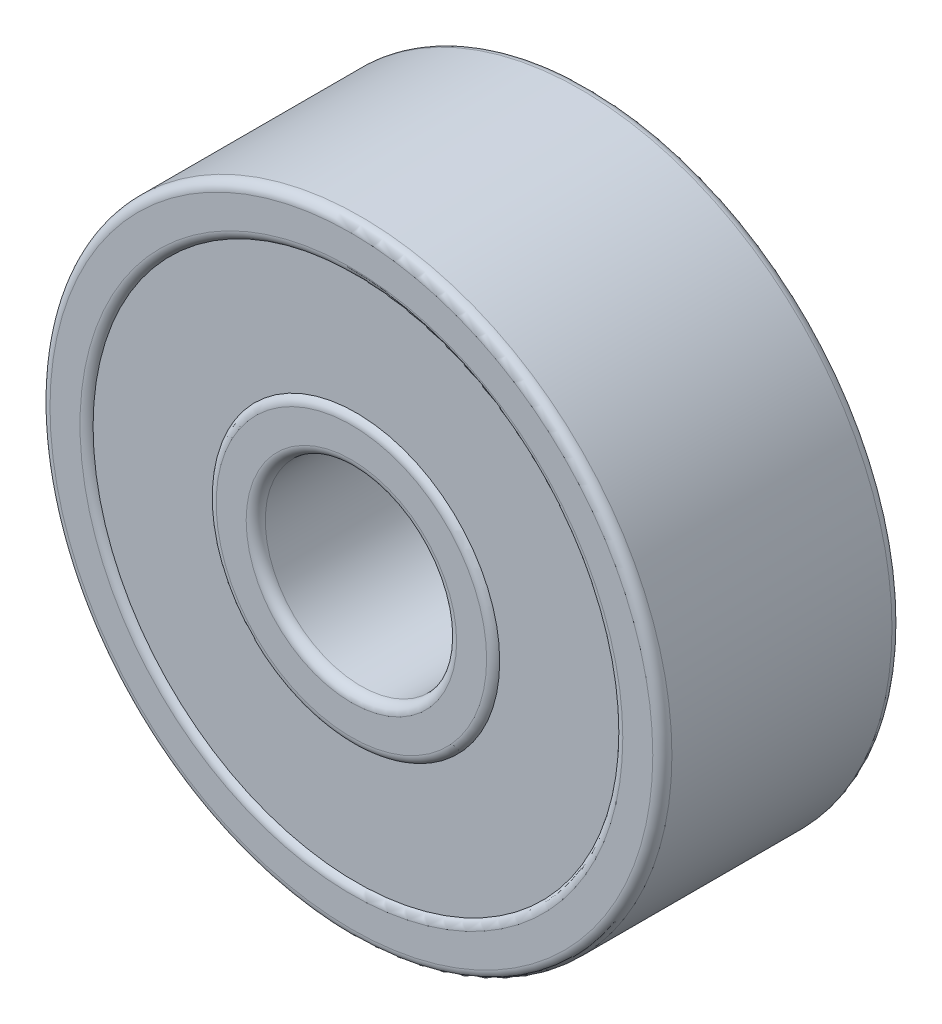
from build123d import *

# Parameters (mm, degrees)
ESQUISSE1_R             = 6.5
ESQUISSE1_R_2           = 5.5
ESQUISSE1_R_3           = 3
ESQUISSE1_R_4           = 2
BOSS_EXTRU_1_DEPTH      = 5
ESQUISSE1_3_R           = 5.5
ESQUISSE1_3_R_2         = 3
ENL_V_MAT_EXTRU_1_DEPTH = 0.1
ENL_V_START             = -0.1
ESQUISSE2_R             = 5.5
ESQUISSE2_R_2           = 3
ENL_V_MAT_EXTRU_2_DEPTH = 0.1
CONG_1_R                = 0.2


with BuildPart() as part:
    # Esquisse1 → Boss.-Extru.1 (new body)
    # profile 1 of 3: a face of its own
    with BuildSketch(Plane.XY):
        Circle(ESQUISSE1_R)
        Circle(ESQUISSE1_R_2, mode=Mode.SUBTRACT)
    # profile 2 of 3: a face of its own
    with BuildSketch(Plane.XY):
        Circle(ESQUISSE1_R_2)
        Circle(ESQUISSE1_R_3, mode=Mode.SUBTRACT)
    # profile 3 of 3: a face of its own
    with BuildSketch(Plane.XY):
        Circle(ESQUISSE1_R_3)
        Circle(ESQUISSE1_R_4, mode=Mode.SUBTRACT)
    extrude(amount=BOSS_EXTRU_1_DEPTH)

    # Esquisse1<3> → Enlèv. mat.-Extru.1 (cut)
    with BuildSketch(Plane.XY):
        Circle(ESQUISSE1_3_R)
        Circle(ESQUISSE1_3_R_2, mode=Mode.SUBTRACT)
    extrude(amount=ENL_V_MAT_EXTRU_1_DEPTH, mode=Mode.SUBTRACT)

    # Esquisse2 → Enlèv. mat.-Extru.2 (cut)
    with BuildSketch(Plane.XY.offset(5).offset(ENL_V_START)):
        Circle(ESQUISSE2_R)
        Circle(ESQUISSE2_R_2, mode=Mode.SUBTRACT)
    extrude(amount=ENL_V_MAT_EXTRU_2_DEPTH, mode=Mode.SUBTRACT)

    # Congé1
    # the kernel refuses this fillet: 0.2 mm, written as the material it takes off along each edge
    with BuildSketch(Plane(origin=(0, 0, 0), x_dir=(1, 0, 0), z_dir=(0, -1, 0))) as cong_1_piece_1:
        with BuildLine():
            CenterArc((5.673205081, 0.2), CONG_1_R, 210, 60)
            Line((5.5, 0.1), (5.496535898, 0.098))
            ThreePointArc((5.496535898, 0.098), (5.496, 0.05), (5.496, 0))
            Line((5.496, 0), (5.5, -0.004))
            Line((5.5, -0.004), (5.673205081, -0.004))
            Line((5.673205081, -0.004), (5.673205081, 0))
        make_face()
    revolve(axis=Axis((0, 0, 0), (0, 0, 1)), mode=Mode.SUBTRACT)
    with BuildSketch(Plane(origin=(0, 0, 0), x_dir=(1, 0, 0), z_dir=(0, -1, 0))) as cong_1_piece_2:
        with BuildLine():
            CenterArc((2.826794919, 0.2), CONG_1_R, 270, 60)
            Line((2.826794919, 0), (2.826794919, -0.004))
            Line((2.826794919, -0.004), (3, -0.004))
            Line((3, -0.004), (3.004, 0))
            ThreePointArc((3.004, 0), (3.004, 0.05), (3.003464102, 0.098))
            Line((3.003464102, 0.098), (3, 0.1))
        make_face()
    revolve(axis=Axis((0, 0, 0), (0, 0, 1)), mode=Mode.SUBTRACT)
    with BuildSketch(Plane(origin=(0, 0, 5), x_dir=(1, 0, 0), z_dir=(0, -1, 0))) as cong_1_piece_3:
        with BuildLine():
            CenterArc((5.673205081, -0.2), CONG_1_R, 90, 60)
            Line((5.5, -0.1), (5.496535898, -0.098))
            ThreePointArc((5.496535898, -0.098), (5.496, -0.05), (5.496, 0))
            Line((5.496, 0), (5.5, 0.004))
            Line((5.5, 0.004), (5.673205081, 0.004))
            Line((5.673205081, 0.004), (5.673205081, 0))
        make_face()
    revolve(axis=Axis((0, 0, 5), (0, 0, 1)), mode=Mode.SUBTRACT)
    with BuildSketch(Plane(origin=(0, 0, 5), x_dir=(1, 0, 0), z_dir=(0, -1, 0))) as cong_1_piece_4:
        with BuildLine():
            CenterArc((2.826794919, -0.2), CONG_1_R, 30, 60)
            Line((2.826794919, 0), (2.826794919, 0.004))
            Line((2.826794919, 0.004), (3, 0.004))
            Line((3, 0.004), (3.004, 0))
            ThreePointArc((3.004, 0), (3.004, -0.05), (3.003464102, -0.098))
            Line((3.003464102, -0.098), (3, -0.1))
        make_face()
    revolve(axis=Axis((0, 0, 5), (0, 0, 1)), mode=Mode.SUBTRACT)
    with BuildSketch(Plane(origin=(0, 0, 0), x_dir=(1, 0, 0), z_dir=(0, -1, 0))) as cong_1_piece_5:
        with BuildLine():
            CenterArc((2 + CONG_1_R, CONG_1_R), CONG_1_R, 180, 90)
            Line((2, CONG_1_R), (2 - CONG_1_R * 0.02, CONG_1_R))
            Line((2 - CONG_1_R * 0.02, CONG_1_R), (2 - CONG_1_R * 0.02, -CONG_1_R * 0.02))
            Line((2 - CONG_1_R * 0.02, -CONG_1_R * 0.02), (2 + CONG_1_R, -CONG_1_R * 0.02))
            Line((2 + CONG_1_R, -CONG_1_R * 0.02), (2 + CONG_1_R, 0))
        make_face()
    revolve(axis=Axis((0, 0, 0), (0, 0, 1)), mode=Mode.SUBTRACT)
    with BuildSketch(Plane(origin=(0, 0, 0), x_dir=(1, 0, 0), z_dir=(0, -1, 0))) as cong_1_piece_6:
        with BuildLine():
            CenterArc((6.5 - CONG_1_R, CONG_1_R), CONG_1_R, 270, 90)
            Line((6.5 - CONG_1_R, 0), (6.5 - CONG_1_R, -CONG_1_R * 0.02))
            Line((6.5 - CONG_1_R, -CONG_1_R * 0.02), (6.5 + CONG_1_R * 0.02, -CONG_1_R * 0.02))
            Line((6.5 + CONG_1_R * 0.02, -CONG_1_R * 0.02), (6.5 + CONG_1_R * 0.02, CONG_1_R))
            Line((6.5 + CONG_1_R * 0.02, CONG_1_R), (6.5, CONG_1_R))
        make_face()
    revolve(axis=Axis((0, 0, 0), (0, 0, 1)), mode=Mode.SUBTRACT)
    with BuildSketch(Plane(origin=(0, 0, 5), x_dir=(1, 0, 0), z_dir=(0, -1, 0))) as cong_1_piece_7:
        with BuildLine():
            CenterArc((6.5 - CONG_1_R, -CONG_1_R), CONG_1_R, 0, 90)
            Line((6.5 - CONG_1_R, 0), (6.5 - CONG_1_R, CONG_1_R * 0.02))
            Line((6.5 - CONG_1_R, CONG_1_R * 0.02), (6.5 + CONG_1_R * 0.02, CONG_1_R * 0.02))
            Line((6.5 + CONG_1_R * 0.02, CONG_1_R * 0.02), (6.5 + CONG_1_R * 0.02, -CONG_1_R))
            Line((6.5 + CONG_1_R * 0.02, -CONG_1_R), (6.5, -CONG_1_R))
        make_face()
    revolve(axis=Axis((0, 0, 5), (0, 0, 1)), mode=Mode.SUBTRACT)
    with BuildSketch(Plane(origin=(0, 0, 5), x_dir=(1, 0, 0), z_dir=(0, -1, 0))) as cong_1_piece_8:
        with BuildLine():
            CenterArc((2 + CONG_1_R, -CONG_1_R), CONG_1_R, 90, 90)
            Line((2, -CONG_1_R), (2 - CONG_1_R * 0.02, -CONG_1_R))
            Line((2 - CONG_1_R * 0.02, -CONG_1_R), (2 - CONG_1_R * 0.02, CONG_1_R * 0.02))
            Line((2 - CONG_1_R * 0.02, CONG_1_R * 0.02), (2 + CONG_1_R, CONG_1_R * 0.02))
            Line((2 + CONG_1_R, CONG_1_R * 0.02), (2 + CONG_1_R, 0))
        make_face()
    revolve(axis=Axis((0, 0, 5), (0, 0, 1)), mode=Mode.SUBTRACT)


solid = part.part
